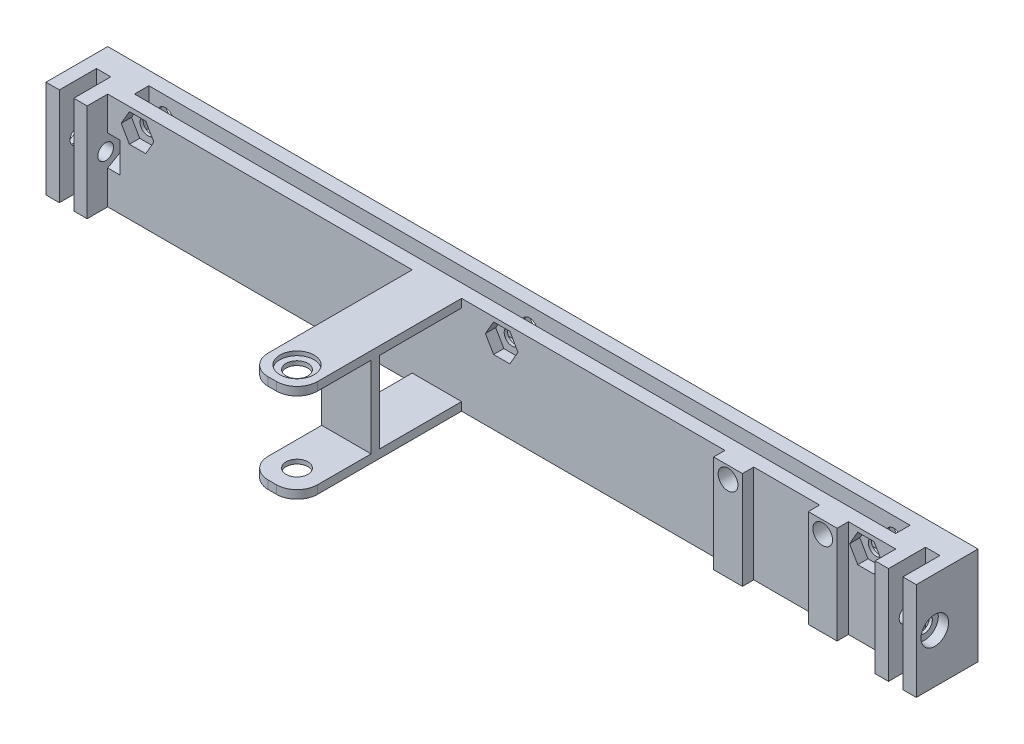
from build123d import *

# Parameters (mm, degrees)
SKETCH2_W            = 23.75
SKETCH2_H            = 12
BOSS_EXTRUDE1_DEPTH  = 10
SKETCH3_W            = 12
SKETCH3_H            = 2.025
BOSS_EXTRUDE2_DEPTH  = 40
FILLET1_R            = 5
FILLET1_OF_MIRROR1_R = 5
SKETCH5_R            = 2.65
CUT_EXTRUDE1_DEPTH   = 57.639760769
SKETCH6_R            = 4.15
CUT_EXTRUDE2_DEPTH   = 1
SKETCH7_W            = 84
SKETCH7_H            = 23.75
SKETCH7_W_2          = 115.5
BOSS_EXTRUDE3_DEPTH  = 10
SKETCH8_W            = 10
SKETCH8_H            = 23.75
BOSS_EXTRUDE4_DEPTH  = 5
BOSS_EXTRUDE7_REACH  = 130.079
SKETCH18_W           = 12
SKETCH18_H           = 2
SKETCH11_W           = 185
SKETCH11_H           = 3.5
CUT_EXTRUDE3_DEPTH   = 9
SKETCH12_R           = 1.9
CUT_EXTRUDE4_DEPTH   = 155.807138078
SKETCH15_R           = 3.35
CUT_EXTRUDE5_DEPTH   = 2.5
SKETCH16_R           = 1.9
CUT_EXTRUDE6_DEPTH   = 2.5
LPATTERN1_COUNT      = 3
LPATTERN1_PITCH      = 88.5
SKETCH14_W           = 7
SKETCH14_H           = 23.75
BOSS_EXTRUDE6_DEPTH  = 2.75
CUT_EXTRUDE7_REACH   = 130.079
SKETCH21_W           = 3.5
SKETCH21_H           = 9
LPATTERN2_COUNT      = 2
LPATTERN2_PITCH      = 201.5
SKETCH22_R           = 2.4
CUT_EXTRUDE8_DEPTH   = 3.8
SKETCH26_R           = 1.75
CUT_EXTRUDE12_DEPTH  = 0.6
LPATTERN3_COUNT      = 2
LPATTERN3_PITCH      = 23
SKETCH23_R           = 1.9
CUT_EXTRUDE9_DEPTH   = 10
SKETCH24_R           = 3.35
CUT_EXTRUDE10_DEPTH  = 2.5
CUT_EXTRUDE11_DEPTH  = 3


with BuildPart() as part:
    # Sketch2 → Boss-Extrude1 (new body)
    with BuildSketch(Plane(origin=(0, 0, 0), x_dir=(0, 1, 0), z_dir=(0, 0, 1))):
        with Locations((-83.125, 6)):
            Rectangle(SKETCH2_W, SKETCH2_H)
    extrude(amount=BOSS_EXTRUDE1_DEPTH)

    # Sketch3 → Boss-Extrude2 (add)
    with BuildSketch(Plane.XY.offset(10)):
        with Locations((-6, -72.2625)):
            Rectangle(SKETCH3_W, SKETCH3_H)
    boss_extrude2 = extrude(amount=BOSS_EXTRUDE2_DEPTH)

    # Fillet1
    fillet1_edges = [part.edges().sort_by_distance(p)[0] for p in [
        (0, -72.2625, 50),
        (-12, -72.2625, 50),
    ]]
    fillet(fillet1_edges, radius=FILLET1_R)

    # Mirror1: Boss-Extrude2 across plane
    add(boss_extrude2.mirror(Plane.ZX.offset(-83.125)))

    # Fillet1 of Mirror1
    fillet1_of_mirror1_edges = [part.edges().sort_by_distance(p)[0] for p in [
        (0, -93.9875, 50),
        (-12, -93.9875, 50),
    ]]
    fillet(fillet1_of_mirror1_edges, radius=FILLET1_OF_MIRROR1_R)

    # Sketch5 → Cut-Extrude1 (cut, through all)
    with BuildSketch(Plane.XZ.offset(95)):
        with Locations((-6, 44)):
            Circle(SKETCH5_R)
    extrude(amount=-CUT_EXTRUDE1_DEPTH, mode=Mode.SUBTRACT)

    # Sketch6 → Cut-Extrude2 (cut)
    with BuildSketch(Plane.XZ.offset(95)):
        with Locations((-6, 44)):
            Circle(SKETCH6_R)
    cut_extrude2 = extrude(amount=-CUT_EXTRUDE2_DEPTH, mode=Mode.SUBTRACT)

    # Mirror2: Cut-Extrude2 across plane
    add(cut_extrude2.mirror(Plane.ZX.offset(-83.125)), mode=Mode.SUBTRACT)

    # Sketch7 → Boss-Extrude3 (add)
    with BuildSketch(Plane(origin=(0, 0, 0), x_dir=(1, 0, 0), z_dir=(0, 0, -1))):
        with Locations((-54, 83.125)):
            Rectangle(SKETCH7_W, SKETCH7_H)
        with Locations((57.75, 83.125)):
            Rectangle(SKETCH7_W_2, SKETCH7_H)
    extrude(amount=-BOSS_EXTRUDE3_DEPTH)

    # Sketch8 → Boss-Extrude4 (add)
    with BuildSketch(Plane.XY.offset(10)):
        with Locations((110.5, -83.125)):
            Rectangle(SKETCH8_W, SKETCH8_H)
        with Locations((-91, -83.125)):
            Rectangle(SKETCH8_W, SKETCH8_H)
    extrude(amount=BOSS_EXTRUDE4_DEPTH)

    # Sketch18 → Boss-Extrude7 (add, up to next)
    with BuildSketch(Plane(origin=(0, -71.25, 0), x_dir=(-1, 0, 0), z_dir=(0, 1, 0)), mode=Mode.PRIVATE) as boss_extrude7_sk1:
        with Locations((6, 31)):
            Rectangle(SKETCH18_W, SKETCH18_H)
    boss_extrude7_tool1 = extrude(boss_extrude7_sk1.sketch, amount=-BOSS_EXTRUDE7_REACH, mode=Mode.PRIVATE) - part.part
    add(boss_extrude7_tool1.solids().sort_by_distance((-6, -71.25, 31))[0])

    # Sketch11 → Cut-Extrude3 (cut)
    with BuildSketch(Plane(origin=(0, -71.25, 0), x_dir=(-1, 0, 0), z_dir=(0, 1, 0))):
        with Locations((-9.75, 5)):
            Rectangle(SKETCH11_W, SKETCH11_H)
    cut_extrude3 = extrude(amount=-CUT_EXTRUDE3_DEPTH, mode=Mode.SUBTRACT)

    # Mirror3: Cut-Extrude3 across plane
    add(cut_extrude3.mirror(Plane.ZX.offset(-83.125)), mode=Mode.SUBTRACT)

    # Sketch12 → Cut-Extrude4 (cut, symmetric)
    with BuildSketch(Plane.XY.offset(10)):
        with Locations((-78.75, -75.75)):
            Circle(SKETCH12_R)
    cut_extrude4 = extrude(amount=CUT_EXTRUDE4_DEPTH, both=True, mode=Mode.SUBTRACT)

    # Sketch15 → Cut-Extrude5 (cut)
    with BuildSketch(Plane.XY):
        with Locations((-78.75, -75.75)):
            Circle(SKETCH15_R)
    cut_extrude5 = extrude(amount=CUT_EXTRUDE5_DEPTH, mode=Mode.SUBTRACT)

    # Sketch16 → Cut-Extrude6 (cut)
    with BuildSketch(Plane.XY.offset(10)):
        Polygon((-80.730940108, -72.318911087), (-82.711880215, -75.75), (-80.730940108, -79.181088913), (-76.769059892, -79.181088913), (-74.788119785, -75.75), (-76.769059892, -72.318911087), align=None)
        with Locations((-78.75, -75.75)):
            Circle(SKETCH16_R, mode=Mode.SUBTRACT)
    cut_extrude6 = extrude(amount=-CUT_EXTRUDE6_DEPTH, mode=Mode.SUBTRACT)

    # LPattern1: Cut-Extrude4, Cut-Extrude5, Cut-Extrude6 ×3
    with Locations(*[(i * LPATTERN1_PITCH, 0, 0) for i in range(1, LPATTERN1_COUNT)]):
        add(cut_extrude4, mode=Mode.SUBTRACT)
        add(cut_extrude5, mode=Mode.SUBTRACT)
        add(cut_extrude6, mode=Mode.SUBTRACT)

    # Sketch14 → Boss-Extrude6 (add)
    with BuildSketch(Plane.XY.offset(10)):
        with Locations((90.5, -83.125)):
            Rectangle(SKETCH14_W, SKETCH14_H)
        with Locations((67.5, -83.125)):
            Rectangle(SKETCH14_W, SKETCH14_H)
    extrude(amount=BOSS_EXTRUDE6_DEPTH)

    # Sketch21 → Cut-Extrude7 (cut, up to next)
    with BuildSketch(Plane(origin=(0, -71.25, 0), x_dir=(-1, 0, 0), z_dir=(0, 1, 0)), mode=Mode.PRIVATE) as cut_extrude7_sk1:
        with Locations((-110.5, 10.5)):
            Rectangle(SKETCH21_W, SKETCH21_H)
    cut_extrude7_tool1 = extrude(cut_extrude7_sk1.sketch, amount=-CUT_EXTRUDE7_REACH, mode=Mode.PRIVATE) & part.part
    cut_extrude7 = cut_extrude7_tool1.solids().sort_by_distance((110.5, -71.25, 10.5))[0]
    add(cut_extrude7, mode=Mode.SUBTRACT)

    # LPattern2: Cut-Extrude7 ×2
    with Locations(*[(-i * LPATTERN2_PITCH, 0, 0) for i in range(1, LPATTERN2_COUNT)]):
        add(cut_extrude7, mode=Mode.SUBTRACT)

    # Sketch22 → Cut-Extrude8 (cut)
    with BuildSketch(Plane.XY.offset(12.75)):
        with Locations((90.5, -74.25)):
            Circle(SKETCH22_R)
    cut_extrude8 = extrude(amount=-CUT_EXTRUDE8_DEPTH, mode=Mode.SUBTRACT)

    # Sketch26 → Cut-Extrude12 (cut)
    with BuildSketch(Plane.XY.offset(8.95)):
        with Locations((90.5, -74.25)):
            Circle(SKETCH26_R)
    cut_extrude12 = extrude(amount=-CUT_EXTRUDE12_DEPTH, mode=Mode.SUBTRACT)

    # LPattern3: Cut-Extrude8, Cut-Extrude12 ×2
    with Locations(*[(-i * LPATTERN3_PITCH, 0, 0) for i in range(1, LPATTERN3_COUNT)]):
        add(cut_extrude8, mode=Mode.SUBTRACT)
        add(cut_extrude12, mode=Mode.SUBTRACT)

    # Sketch23 → Cut-Extrude9 (cut)
    with BuildSketch(Plane.YZ.offset(115.5)):
        with Locations((-83.125, 10.5)):
            Circle(SKETCH23_R)
    cut_extrude9 = extrude(amount=-CUT_EXTRUDE9_DEPTH, mode=Mode.SUBTRACT)

    # Sketch24 → Cut-Extrude10 (cut)
    with BuildSketch(Plane.YZ.offset(115.5)):
        with Locations((-83.125, 10.5)):
            Circle(SKETCH24_R)
    cut_extrude10 = extrude(amount=-CUT_EXTRUDE10_DEPTH, mode=Mode.SUBTRACT)

    # Sketch25 → Cut-Extrude11 (cut)
    with BuildSketch(Plane(origin=(105.5, 0, 0), x_dir=(0, -1, 0), z_dir=(-1, 0, 0))):
        Polygon((81.144059892, 13.931088913), (79.163119785, 10.5), (81.144059892, 7.068911087), (85.105940108, 7.068911087), (87.086880215, 10.5), (85.105940108, 13.931088913), align=None)
    cut_extrude11 = extrude(amount=CUT_EXTRUDE11_DEPTH, mode=Mode.SUBTRACT)

    # Mirror4: Cut-Extrude9, Cut-Extrude10, Cut-Extrude11 across plane
    add(cut_extrude9.mirror(Plane(origin=(9.75, 0, 0), x_dir=(0, 0, 1), z_dir=(1, 0, 0))), mode=Mode.SUBTRACT)
    add(cut_extrude10.mirror(Plane(origin=(9.75, 0, 0), x_dir=(0, 0, 1), z_dir=(1, 0, 0))), mode=Mode.SUBTRACT)
    add(cut_extrude11.mirror(Plane(origin=(9.75, 0, 0), x_dir=(0, 0, 1), z_dir=(1, 0, 0))), mode=Mode.SUBTRACT)


solid = part.part
